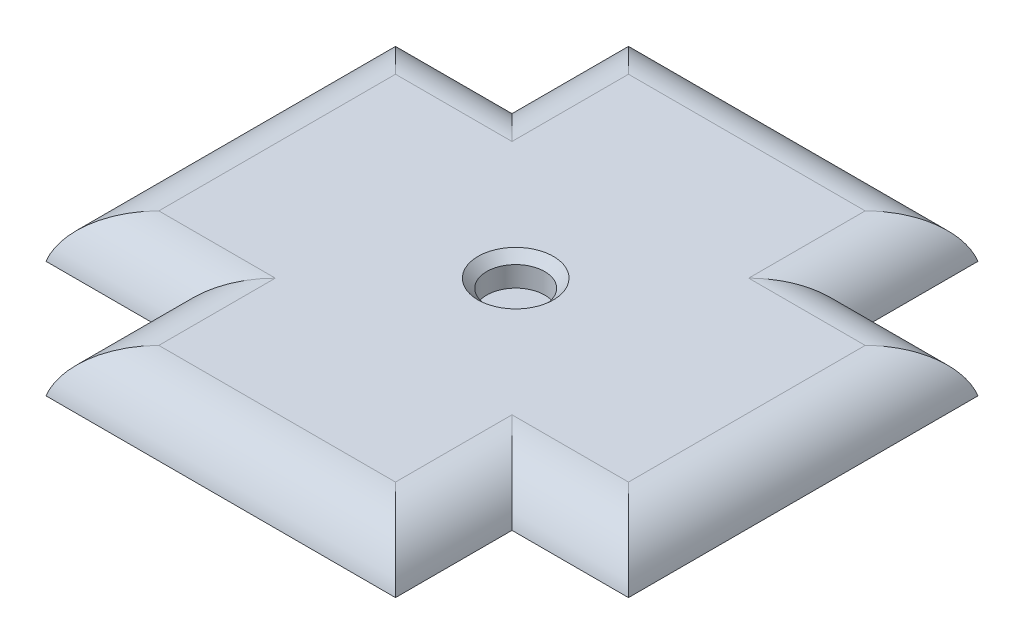
from build123d import *

# Parameters (mm, degrees)
BOSS_EXTRUDE1_DEPTH = 7.5
FILLET1_R           = 10
SKETCH2_R           = 4.975
CUT_EXTRUDE1_DEPTH  = 5
CHAMFER2_SIZE       = 1.5


with BuildPart() as part:
    # Sketch1 → Boss-Extrude1 (new body)
    with BuildSketch(Plane(origin=(0, 0, 0), x_dir=(1, 0, 0), z_dir=(0, 1, 0))):
        Polygon((80, 0), (20, 0), (20, -20), (0, -20), (0, -80), (20, -80), (20, -100), (80, -100), (80, -80), (100, -80), (100, -20), (80, -20), align=None)
    extrude(amount=BOSS_EXTRUDE1_DEPTH)

    # Fillet1
    # the kernel refuses this fillet: 10 mm, written as the material it takes off along each edge
    with BuildSketch(Plane(origin=(-24.206145914, 7.5, 80), x_dir=(0, -1, 0), z_dir=(1, 0, 0)), Plane(origin=(20, 7.5, 80), x_dir=(0, -1, 0), z_dir=(0, 0, 1)), Plane(origin=(80, 7.5, 124.206145914), x_dir=(0, -1, 0), z_dir=(0, 0, -1)), Plane(origin=(80, 7.5, 80), x_dir=(0, -1, 0), z_dir=(1, 0, 0)), Plane(origin=(124.206145914, 7.5, 20), x_dir=(0, -1, 0), z_dir=(-1, 0, 0)), Plane(origin=(80, 7.5, 20), x_dir=(0, -1, 0), z_dir=(0, 0, -1)), Plane(origin=(20, 7.5, -24.206145914), x_dir=(0, -1, 0), z_dir=(0, 0, 1)), Plane(origin=(20, 7.5, 20), x_dir=(0, -1, 0), z_dir=(-1, 0, 0))) as fillet1_piece_1:
        with BuildLine():
            CenterArc((10, 9.682458366), FILLET1_R, 180, 75.522487814)
            Line((0, 9.682458366), (-0.2, 9.682458366))
            Line((-0.2, 9.682458366), (-0.2, 0))
            Line((-0.2, 0), (0, -0.2))
            ThreePointArc((0, -0.2), (3.75, -0.2), (7.45, -0.193649167))
            Line((7.45, -0.193649167), (7.5, 0))
        make_face()
    extrude(amount=44.206145914, mode=Mode.SUBTRACT)
    with BuildSketch(Plane(origin=(-4.206145914, 7.5, 100), x_dir=(0, -1, 0), z_dir=(1, 0, 0)), Plane(origin=(100, 7.5, 104.206145914), x_dir=(0, -1, 0), z_dir=(0, 0, -1)), Plane(origin=(104.206145914, 7.5, 0), x_dir=(0, -1, 0), z_dir=(-1, 0, 0)), Plane(origin=(0, 7.5, -4.206145914), x_dir=(0, -1, 0), z_dir=(0, 0, 1))) as fillet1_piece_2:
        with BuildLine():
            CenterArc((10, 9.682458366), FILLET1_R, 180, 75.522487814)
            Line((0, 9.682458366), (-0.2, 9.682458366))
            Line((-0.2, 9.682458366), (-0.2, 0))
            Line((-0.2, 0), (0, -0.2))
            ThreePointArc((0, -0.2), (3.75, -0.2), (7.45, -0.193649167))
            Line((7.45, -0.193649167), (7.5, 0))
        make_face()
    extrude(amount=108.412291828, mode=Mode.SUBTRACT)
    with BuildSketch(Plane(origin=(-24.206145914, 7.5, 80), x_dir=(0, -1, 0), z_dir=(1, 0, 0))) as fillet1_piece_3a_section:
        with BuildLine():
            CenterArc((10, 9.682458366), FILLET1_R, 180, 75.522487814)
            Line((0, 9.682458366), (-0.2, 9.682458366))
            Line((-0.2, 9.682458366), (-0.2, 0))
            Line((-0.2, 0), (0, -0.2))
            ThreePointArc((0, -0.2), (3.75, -0.2), (7.45, -0.193649167))
            Line((7.45, -0.193649167), (7.5, 0))
        make_face()
    fillet1_piece_3a = extrude(amount=68.412291828, mode=Mode.PRIVATE)
    fillet1_piece_3a = split(fillet1_piece_3a, bisect_by=Plane(origin=(20, 5.604082443, 77.718558992), z_dir=(1, 0, 0)), keep=Keep.TOP, mode=Mode.PRIVATE)
    with BuildSketch(Plane(origin=(20, 7.5, 55.793854086), x_dir=(0, -1, 0), z_dir=(0, 0, 1))) as fillet1_piece_3b_section:
        with BuildLine():
            CenterArc((10, 9.682458366), FILLET1_R, 180, 75.522487814)
            Line((0, 9.682458366), (-0.2, 9.682458366))
            Line((-0.2, 9.682458366), (-0.2, 0))
            Line((-0.2, 0), (0, -0.2))
            ThreePointArc((0, -0.2), (3.75, -0.2), (7.45, -0.193649167))
            Line((7.45, -0.193649167), (7.5, 0))
        make_face()
    fillet1_piece_3b = extrude(amount=68.412291828, mode=Mode.PRIVATE)
    fillet1_piece_3b = split(fillet1_piece_3b, bisect_by=Plane(origin=(22.281441008, 5.604082443, 80), z_dir=(0, 0, -1)), keep=Keep.TOP, mode=Mode.PRIVATE)
    fillet1_piece_3 = fillet1_piece_3a & fillet1_piece_3b
    add(fillet1_piece_3, mode=Mode.SUBTRACT)
    with BuildSketch(Plane(origin=(80, 7.5, 124.206145914), x_dir=(0, -1, 0), z_dir=(0, 0, -1))) as fillet1_piece_4a_section:
        with BuildLine():
            CenterArc((10, 9.682458366), FILLET1_R, 180, 75.522487814)
            Line((0, 9.682458366), (-0.2, 9.682458366))
            Line((-0.2, 9.682458366), (-0.2, 0))
            Line((-0.2, 0), (0, -0.2))
            ThreePointArc((0, -0.2), (3.75, -0.2), (7.45, -0.193649167))
            Line((7.45, -0.193649167), (7.5, 0))
        make_face()
    fillet1_piece_4a = extrude(amount=68.412291828, mode=Mode.PRIVATE)
    fillet1_piece_4a = split(fillet1_piece_4a, bisect_by=Plane(origin=(77.718558992, 5.604082443, 80), z_dir=(0, 0, -1)), keep=Keep.TOP, mode=Mode.PRIVATE)
    with BuildSketch(Plane(origin=(55.793854086, 7.5, 80), x_dir=(0, -1, 0), z_dir=(1, 0, 0))) as fillet1_piece_4b_section:
        with BuildLine():
            CenterArc((10, 9.682458366), FILLET1_R, 180, 75.522487814)
            Line((0, 9.682458366), (-0.2, 9.682458366))
            Line((-0.2, 9.682458366), (-0.2, 0))
            Line((-0.2, 0), (0, -0.2))
            ThreePointArc((0, -0.2), (3.75, -0.2), (7.45, -0.193649167))
            Line((7.45, -0.193649167), (7.5, 0))
        make_face()
    fillet1_piece_4b = extrude(amount=68.412291828, mode=Mode.PRIVATE)
    fillet1_piece_4b = split(fillet1_piece_4b, bisect_by=Plane(origin=(80, 5.604082443, 77.718558992), z_dir=(-1, 0, 0)), keep=Keep.TOP, mode=Mode.PRIVATE)
    fillet1_piece_4 = fillet1_piece_4a & fillet1_piece_4b
    add(fillet1_piece_4, mode=Mode.SUBTRACT)
    with BuildSketch(Plane(origin=(124.206145914, 7.5, 20), x_dir=(0, -1, 0), z_dir=(-1, 0, 0))) as fillet1_piece_5a_section:
        with BuildLine():
            CenterArc((10, 9.682458366), FILLET1_R, 180, 75.522487814)
            Line((0, 9.682458366), (-0.2, 9.682458366))
            Line((-0.2, 9.682458366), (-0.2, 0))
            Line((-0.2, 0), (0, -0.2))
            ThreePointArc((0, -0.2), (3.75, -0.2), (7.45, -0.193649167))
            Line((7.45, -0.193649167), (7.5, 0))
        make_face()
    fillet1_piece_5a = extrude(amount=68.412291828, mode=Mode.PRIVATE)
    fillet1_piece_5a = split(fillet1_piece_5a, bisect_by=Plane(origin=(80, 5.604082443, 22.281441008), z_dir=(-1, 0, 0)), keep=Keep.TOP, mode=Mode.PRIVATE)
    with BuildSketch(Plane(origin=(80, 7.5, 44.206145914), x_dir=(0, -1, 0), z_dir=(0, 0, -1))) as fillet1_piece_5b_section:
        with BuildLine():
            CenterArc((10, 9.682458366), FILLET1_R, 180, 75.522487814)
            Line((0, 9.682458366), (-0.2, 9.682458366))
            Line((-0.2, 9.682458366), (-0.2, 0))
            Line((-0.2, 0), (0, -0.2))
            ThreePointArc((0, -0.2), (3.75, -0.2), (7.45, -0.193649167))
            Line((7.45, -0.193649167), (7.5, 0))
        make_face()
    fillet1_piece_5b = extrude(amount=68.412291828, mode=Mode.PRIVATE)
    fillet1_piece_5b = split(fillet1_piece_5b, bisect_by=Plane(origin=(77.718558992, 5.604082443, 20), z_dir=(0, 0, 1)), keep=Keep.TOP, mode=Mode.PRIVATE)
    fillet1_piece_5 = fillet1_piece_5a & fillet1_piece_5b
    add(fillet1_piece_5, mode=Mode.SUBTRACT)
    with BuildSketch(Plane(origin=(20, 7.5, -24.206145914), x_dir=(0, -1, 0), z_dir=(0, 0, 1))) as fillet1_piece_6a_section:
        with BuildLine():
            CenterArc((10, 9.682458366), FILLET1_R, 180, 75.522487814)
            Line((0, 9.682458366), (-0.2, 9.682458366))
            Line((-0.2, 9.682458366), (-0.2, 0))
            Line((-0.2, 0), (0, -0.2))
            ThreePointArc((0, -0.2), (3.75, -0.2), (7.45, -0.193649167))
            Line((7.45, -0.193649167), (7.5, 0))
        make_face()
    fillet1_piece_6a = extrude(amount=68.412291828, mode=Mode.PRIVATE)
    fillet1_piece_6a = split(fillet1_piece_6a, bisect_by=Plane(origin=(22.281441008, 5.604082443, 20), z_dir=(0, 0, 1)), keep=Keep.TOP, mode=Mode.PRIVATE)
    with BuildSketch(Plane(origin=(44.206145914, 7.5, 20), x_dir=(0, -1, 0), z_dir=(-1, 0, 0))) as fillet1_piece_6b_section:
        with BuildLine():
            CenterArc((10, 9.682458366), FILLET1_R, 180, 75.522487814)
            Line((0, 9.682458366), (-0.2, 9.682458366))
            Line((-0.2, 9.682458366), (-0.2, 0))
            Line((-0.2, 0), (0, -0.2))
            ThreePointArc((0, -0.2), (3.75, -0.2), (7.45, -0.193649167))
            Line((7.45, -0.193649167), (7.5, 0))
        make_face()
    fillet1_piece_6b = extrude(amount=68.412291828, mode=Mode.PRIVATE)
    fillet1_piece_6b = split(fillet1_piece_6b, bisect_by=Plane(origin=(20, 5.604082443, 22.281441008), z_dir=(1, 0, 0)), keep=Keep.TOP, mode=Mode.PRIVATE)
    fillet1_piece_6 = fillet1_piece_6a & fillet1_piece_6b
    add(fillet1_piece_6, mode=Mode.SUBTRACT)

    # Sketch2 → Cut-Extrude1 (cut)
    with BuildSketch(Plane(origin=(0, 7.5, 0), x_dir=(1, 0, 0), z_dir=(0, 1, 0))):
        with Locations(Location((50.317541634, -49.682458366, 0), (0, 0, 270))):
            Circle(SKETCH2_R)
    extrude(amount=-CUT_EXTRUDE1_DEPTH, mode=Mode.SUBTRACT)

    # Chamfer2
    chamfer2_edges = [part.edges().sort_by_distance(p)[0] for p in [
        (50.317541634, 7.5, 44.707458366),
    ]]
    chamfer(chamfer2_edges, length=CHAMFER2_SIZE)


solid = part.part
